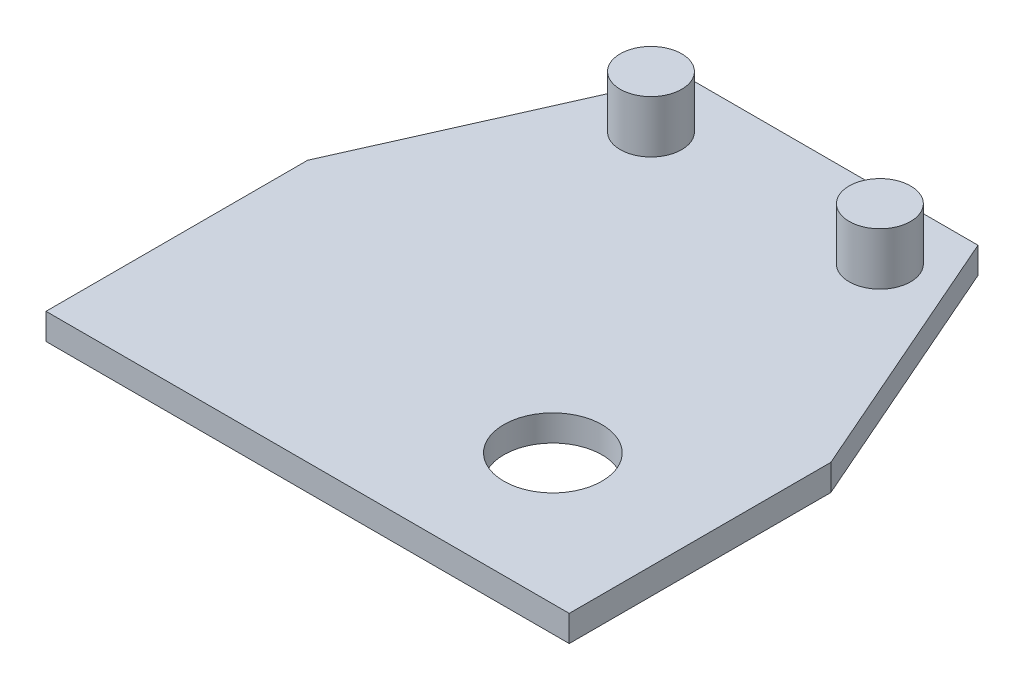
from build123d import *

# Parameters (mm, degrees)
SKETCH1_W           = 40
SKETCH1_H           = 20
BOSS_EXTRUDE1_DEPTH = 2
SKETCH5_W           = 50
SKETCH5_H           = 20
BOSS_EXTRUDE4_DEPTH = 2
SKETCH6_R           = 2.35
BOSS_EXTRUDE5_DEPTH = 4
SKETCH15_R          = 3.75
CUT_EXTRUDE6_DEPTH  = 6
SKETCH17_W          = 10
SKETCH17_H          = 20
CUT_EXTRUDE8_DEPTH  = 43.614551505
CUT_EXTRUDE9_DEPTH  = 2


with BuildPart() as part:
    # Sketch1 → Boss-Extrude1 (new body)
    with BuildSketch(Plane(origin=(0, 0, 0), x_dir=(1, 0, 0), z_dir=(0, 1, 0))):
        Rectangle(SKETCH1_W, SKETCH1_H)
    extrude(amount=BOSS_EXTRUDE1_DEPTH)

    # Sketch5 → Boss-Extrude4 (add)
    with BuildSketch(Plane(origin=(0, 2, 0), x_dir=(1, 0, 0), z_dir=(0, 1, 0))):
        with Locations((5, 20)):
            Rectangle(SKETCH5_W, SKETCH5_H)
    extrude(amount=-BOSS_EXTRUDE4_DEPTH)

    # Sketch6 → Boss-Extrude5 (add)
    with BuildSketch(Plane(origin=(0, 2, 0), x_dir=(1, 0, 0), z_dir=(0, 1, 0))):
        with Locations((-8.75, 25)):
            Circle(SKETCH6_R)
        with Locations((8.75, 25)):
            Circle(SKETCH6_R)
    extrude(amount=BOSS_EXTRUDE5_DEPTH)

    # Sketch15 → Cut-Extrude6 (cut)
    with BuildSketch(Plane(origin=(0, 2, 0), x_dir=(1, 0, 0), z_dir=(0, 1, 0))):
        with Locations((8.75, 0)):
            Circle(SKETCH15_R)
    extrude(amount=-CUT_EXTRUDE6_DEPTH, mode=Mode.SUBTRACT)

    # Sketch17 → Cut-Extrude8 (cut, through all)
    with BuildSketch(Plane(origin=(0, 2, 0), x_dir=(1, 0, 0), z_dir=(0, 1, 0))):
        with Locations((25, 20)):
            Rectangle(SKETCH17_W, SKETCH17_H)
    extrude(amount=-CUT_EXTRUDE8_DEPTH, mode=Mode.SUBTRACT)

    # Sketch18 → Cut-Extrude9 (cut)
    with BuildSketch(Plane(origin=(0, 2, 0), x_dir=(1, 0, 0), z_dir=(0, 1, 0))):
        Polygon((-11.1, 30), (-20, 10), (-20, 30), align=None)
        Polygon((20, 10), (11.25, 30), (20, 30), align=None)
    extrude(amount=-CUT_EXTRUDE9_DEPTH, mode=Mode.SUBTRACT)


solid = part.part
